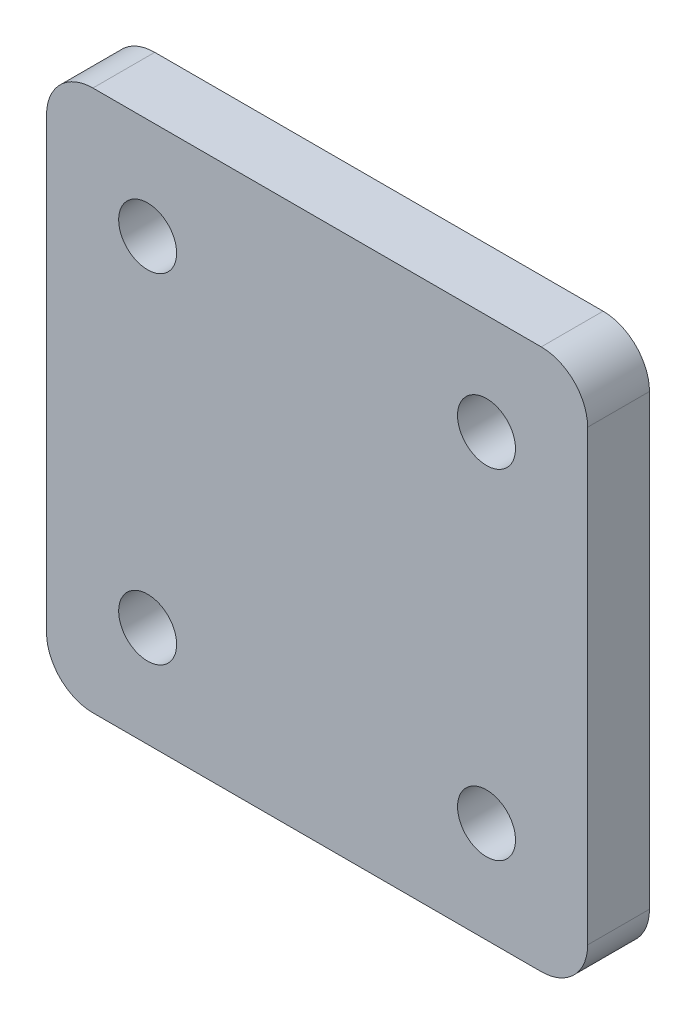
from build123d import *

# Parameters (mm, degrees)
SM_BASE_FLANGE_1_DEPTH = 4
M4X0_251_D             = 3.75
M4X0_251_DEPTH         = 9.25
M4X0_251_TIP           = 1.126613661


# Sheet-metal steps are written as plain solids
with BuildPart() as part:
    # Sketch 1 → Базовая кромка1 (new body)
    with BuildSketch(Plane.XY):
        with BuildLine():
            Line((-14.5, -17.5), (14.5, -17.5))
            ThreePointArc((14.5, -17.5), (16.621320344, -16.621320344), (17.5, -14.5))
            Line((17.5, -14.5), (17.5, 14.5))
            ThreePointArc((17.5, 14.5), (16.621320344, 16.621320344), (14.5, 17.5))
            Line((14.5, 17.5), (-14.5, 17.5))
            ThreePointArc((-14.5, 17.5), (-16.621320344, 16.621320344), (-17.5, 14.5))
            Line((-17.5, 14.5), (-17.5, -14.5))
            ThreePointArc((-17.5, -14.5), (-16.621320344, -16.621320344), (-14.5, -17.5))
        make_face()
    extrude(amount=SM_BASE_FLANGE_1_DEPTH)

    # Отверстие обработанное метчиком M4x0.251
    with Locations(Plane(origin=(0, 0, 0), x_dir=(-1, 0, 0), z_dir=(0, 0, -1))):
        with Locations((-10.960155108, 10.960155108), (10.960155108, 10.960155108), (10.960155108, -10.960155108), (-10.960155108, -10.960155108)):
            Hole(M4X0_251_D / 2, depth=M4X0_251_DEPTH)
            with Locations((0, 0, -(M4X0_251_DEPTH + M4X0_251_TIP / 2))):  # 118° drill point
                Cone(0, M4X0_251_D / 2, M4X0_251_TIP, mode=Mode.SUBTRACT)


solid = part.part
